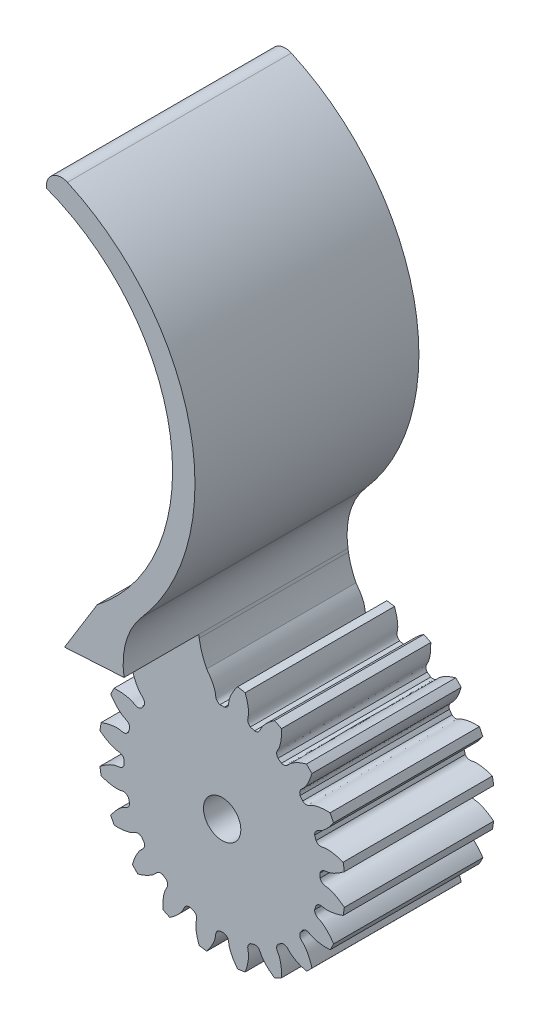
from build123d import *

# Parameters (mm, degrees)
SKETCH_1_R               = 16.5
EXTRUDE_1_DEPTH          = 20
CUT_EXTRUDE_1_DEPTH      = 31.732718721
PATTERN_CIRCULAR_1_COUNT = 20
EXTRUDE_START            = -20
EXTRUDE_2_DEPTH          = 20
FILLET_1_R               = 10
FILLET_2_R               = 2
FILLET_4_R               = 10
SKETCH_5_R               = 2.5
CUT_EXTRUDE_2_DEPTH      = 20
EXTRUDE_3_DEPTH          = 10


with BuildPart() as part:
    # 草图1 → 凸台-拉伸1 (new body)
    with BuildSketch(Plane.XY):
        Circle(SKETCH_1_R)
    extrude(amount=EXTRUDE_1_DEPTH)

    # 草图2 → 切除-拉伸1 (cut, through all)
    with BuildSketch(Plane.XY):
        with BuildLine():
            ThreePointArc((0.289974901, 13.121796354), (0, 13.125), (-0.289974901, 13.121796354))
            add(Edge.make_bspline(
                [(-0.289974901, 13.121796354), (-0.916784107, 13.340213268), (-0.835626149, 13.780670548), (-0.919345585, 14.205014104), (-0.928338279, 14.246334921), (-0.939466335, 14.292951923), (-0.952938145, 14.344795254), (-0.96896871, 14.401787245), (-0.987768083, 14.463844242), (-1.009544807, 14.5308761), (-1.034504625, 14.602786421), (-1.06285065, 14.679472568), (-1.094783098, 14.760825751), (-1.130499153, 14.846731096), (-1.170192797, 14.937067727), (-1.214054647, 15.031708847), (-1.2622718, 15.130521826), (-1.315027675, 15.233368292), (-1.372501858, 15.340104225), (-1.434869948, 15.450580056), (-1.502303414, 15.564640771), (-1.574969439, 15.682126017), (-1.653030782, 15.802870208), (-1.736645634, 15.926702646), (-1.825967477, 16.05344763), (-1.921144951, 16.182924586), (-2.022321721, 16.314948181), (-2.129636342, 16.449328459), (-2.24322214, 16.585870967), (-2.363207078, 16.724376892), (-2.489713645, 16.864643194), (-2.622858733, 17.006462752), (-2.762753527, 17.149624504), (-2.909503389, 17.29391359), (-3.06320776, 17.439111509), (-3.223960048, 17.584996263), (-3.391847534, 17.731342516), (-3.566951278, 17.877921749), (-3.749346018, 18.024502419), (-3.939100102, 18.170850122), (-4.136275349, 18.31672776), (-4.412210386, 18.512459802), (-4.625898619, 18.654498902), (-4.771736973, 18.747377789)],
                knots=[0, 0, 0, 0, 0.165916003, 0.170905922, 0.176663519, 0.183188797, 0.190481754, 0.198542391, 0.207370708, 0.216966704, 0.22733038, 0.238461736, 0.250360771, 0.263027487, 0.276461881, 0.290663956, 0.30563371, 0.321371144, 0.337876258, 0.355149051, 0.373189524, 0.391997677, 0.411573509, 0.431917021, 0.453028213, 0.474907084, 0.497553636, 0.520967867, 0.545149777, 0.570099367, 0.595816637, 0.622301587, 0.649554216, 0.677574526, 0.706362514, 0.735918183, 0.766241531, 0.797332559, 0.829191267, 0.861817654, 0.895211721, 0.929373468, 1, 1, 1, 1], degree=3))
            ThreePointArc((-4.771736973, 18.747377789), (0, 19.345119481), (4.771736973, 18.747377789))
            add(Edge.make_bspline(
                [(0.289974901, 13.121796354), (0.916784107, 13.340213268), (0.835626149, 13.780670548), (0.919345585, 14.205014104), (0.928338279, 14.246334921), (0.939466335, 14.292951923), (0.952938145, 14.344795254), (0.96896871, 14.401787245), (0.987768083, 14.463844242), (1.009544807, 14.5308761), (1.034504625, 14.602786421), (1.06285065, 14.679472568), (1.094783098, 14.760825751), (1.130499153, 14.846731096), (1.170192797, 14.937067727), (1.214054647, 15.031708847), (1.2622718, 15.130521826), (1.315027675, 15.233368292), (1.372501858, 15.340104225), (1.434869948, 15.450580056), (1.502303414, 15.564640771), (1.574969439, 15.682126017), (1.653030782, 15.802870208), (1.736645634, 15.926702646), (1.825967477, 16.05344763), (1.921144951, 16.182924586), (2.022321721, 16.314948181), (2.129636342, 16.449328459), (2.24322214, 16.585870967), (2.363207078, 16.724376892), (2.489713645, 16.864643194), (2.622858733, 17.006462752), (2.762753527, 17.149624504), (2.909503389, 17.29391359), (3.06320776, 17.439111509), (3.223960048, 17.584996263), (3.391847534, 17.731342516), (3.566951278, 17.877921749), (3.749346018, 18.024502419), (3.939100102, 18.170850122), (4.136275349, 18.31672776), (4.412210386, 18.512459802), (4.625898619, 18.654498902), (4.771736973, 18.747377789)],
                knots=[0, 0, 0, 0, 0.165916003, 0.170905922, 0.176663519, 0.183188797, 0.190481754, 0.198542391, 0.207370708, 0.216966704, 0.22733038, 0.238461736, 0.250360771, 0.263027487, 0.276461881, 0.290663956, 0.30563371, 0.321371144, 0.337876258, 0.355149051, 0.373189524, 0.391997677, 0.411573509, 0.431917021, 0.453028213, 0.474907084, 0.497553636, 0.520967867, 0.545149777, 0.570099367, 0.595816637, 0.622301587, 0.649554216, 0.677574526, 0.706362514, 0.735918183, 0.766241531, 0.797332559, 0.829191267, 0.861817654, 0.895211721, 0.929373468, 1, 1, 1, 1], degree=3))
        make_face()
    cut_extrude_1 = extrude(amount=CUT_EXTRUDE_1_DEPTH, mode=Mode.SUBTRACT)

    # 阵列(圆周)1: 切除-拉伸1 ×20 about axis
    pattern_circular_1_axis = Axis((0, 0, -1.5), (0, 0, 1))
    for i in range(1, PATTERN_CIRCULAR_1_COUNT):
        add(cut_extrude_1.rotate(pattern_circular_1_axis, i * 360 / PATTERN_CIRCULAR_1_COUNT), mode=Mode.SUBTRACT)


with BuildPart() as extrude_2_tool:
    # 草图4 → 凸台-拉伸2 (new body)
    with BuildSketch(Plane.XY.offset(20).offset(EXTRUDE_START)):
        with BuildLine():
            Line((-3.093231062, 16.207464996), (-2.581168673, 16.29685762))
            Line((-2.581168673, 16.29685762), (-3.943179305, 24.896254312))
            ThreePointArc((-3.943179305, 24.896254312), (5.496479925, 54.08322336), (-16.546718658, 75.415914817))
            Line((-16.546718658, 75.415914817), (-13.532827403, 71.415914817))
            ThreePointArc((-13.532827403, 71.415914817), (3.341214432, 48.022182491), (-11.762983934, 23.448554518))
            Line((-11.762983934, 23.448554518), (-10.429455191, 15.028985398))
            Line((-10.429455191, 15.028985398), (-9.866251186, 11.473055258))
            add(Edge.make_bspline(
                [(-9.86625116, 11.473055308), (-9.818790017, 11.447845476), (-9.715705209, 11.391138486), (-9.589612349, 11.315967266), (-9.466858859, 11.237556123), (-9.37982057, 11.17834971), (-9.300755502, 11.120900284), (-9.249070303, 11.081745113), (-9.202602252, 11.045060153), (-9.150343301, 11.002082969), (-9.104978437, 10.962582681), (-8.776110671, 10.657627941), (-8.582874544, 10.253587065), (-7.947393003, 10.445313277)],
                knots=[0.701586416, 0.701586416, 0.701586416, 0.701586416, 0.723538119, 0.749639229, 0.761538264, 0.783033296, 0.792629292, 0.801457609, 0.809518246, 0.816811203, 0.829094078, 0.834083997, 1, 1, 1, 1], degree=3))
            ThreePointArc((-7.947393003, 10.445313277), (-7.714681436, 10.618348051), (-7.478203758, 10.786199217))
            add(Edge.make_bspline(
                [(-7.478203758, 10.786199217), (-7.099486698, 11.33133142), (-7.424039159, 11.639965394), (-7.612442624, 12.046973423), (-7.635991116, 12.102324233), (-7.660715943, 12.16530613), (-7.681245996, 12.220836149), (-7.71083511, 12.306060717), (-7.748703597, 12.427161912), (-7.792731572, 12.590510669), (-7.835215538, 12.777480211), (-7.874329115, 12.988173006), (-7.908236264, 13.222583157), (-7.935097524, 13.480595599), (-7.953075711, 13.761985925), (-7.960341751, 14.066420428), (-7.956565619, 14.30111124), (-7.951281332, 14.434194698), (-7.950219677, 14.458354231)],
                knots=[0, 0, 0, 0, 0.165916003, 0.170905922, 0.183188797, 0.190481754, 0.198542391, 0.207370708, 0.22733038, 0.250360771, 0.276461881, 0.30563371, 0.337876258, 0.373189524, 0.411573509, 0.453028213, 0.497553636, 0.507431698, 0.507431698, 0.507431698, 0.507431698], degree=3))
            ThreePointArc((-7.950219677, 14.458354231), (-7.490843246, 14.701607649), (-7.024032405, 14.930270218))
            add(Edge.make_bspline(
                [(-7.024032405, 14.930270218), (-6.912948778, 14.856790614), (-6.720224904, 14.722766352), (-6.458979768, 14.52326582), (-6.24189748, 14.343324096), (-6.048949658, 14.169936981), (-5.879237949, 14.004722705), (-5.731774221, 13.849237063), (-5.623437121, 13.725477592), (-5.530921989, 13.612971249), (-5.466439445, 13.529766293), (-5.408996946, 13.450696193), (-5.371941014, 13.397485807), (-5.339083547, 13.34823692), (-5.302663012, 13.291214284), (-5.271724722, 13.239628764), (-5.053189088, 12.847973843), (-4.994266108, 12.403994888), (-4.330640589, 12.389962756)],
                knots=[0.492568302, 0.492568302, 0.492568302, 0.492568302, 0.546971787, 0.588426491, 0.626810476, 0.662123742, 0.69436629, 0.723538119, 0.749639229, 0.761538264, 0.783033296, 0.792629292, 0.801457609, 0.809518246, 0.816811203, 0.829094078, 0.834083997, 1, 1, 1, 1], degree=3))
            ThreePointArc((-4.330640589, 12.389962756), (-4.055848051, 12.482616776), (-3.779075551, 12.5691771))
            add(Edge.make_bspline(
                [(-3.779075551, 12.5691771), (-3.250439109, 12.970598627), (-3.463733699, 13.364419205), (-3.517143644, 13.809726715), (-3.522435249, 13.869645348), (-3.526487481, 13.937185083), (-3.528853002, 13.996341404), (-3.530658082, 14.086538325), (-3.529250826, 14.213414411), (-3.520646377, 14.382373703), (-3.503274264, 14.573320573), (-3.475365832, 14.785788088), (-3.435176726, 15.019203275), (-3.380993074, 15.272888275), (-3.311136952, 15.546061943), (-3.223971932, 15.837841691), (-3.147857168, 16.059879028), (-3.101706462, 16.184815984), (-3.093231062, 16.207464996)],
                knots=[0, 0, 0, 0, 0.165916003, 0.170905922, 0.183188797, 0.190481754, 0.198542391, 0.207370708, 0.22733038, 0.250360771, 0.276461881, 0.30563371, 0.337876258, 0.373189524, 0.411573509, 0.453028213, 0.497553636, 0.507431698, 0.507431698, 0.507431698, 0.507431698], degree=3))
        make_face()
        with BuildLine():
            Line((-9.866251186, 11.473055258), (-10.429455191, 15.028985398))
            Line((-10.429455191, 15.028985398), (-11.293959017, 12.028985398))
            add(Edge.make_bspline(
                [(-11.293959017, 12.028985398), (-11.165605763, 11.993428871), (-10.940898693, 11.925519176), (-10.630790749, 11.816512081), (-10.368728174, 11.712459448), (-10.131644325, 11.607182659), (-9.967401155, 11.526255764), (-9.881861585, 11.481347063), (-9.86625116, 11.473055308)],
                knots=[0.492568302, 0.492568302, 0.492568302, 0.492568302, 0.546971787, 0.588426491, 0.626810476, 0.662123742, 0.69436629, 0.701586416, 0.701586416, 0.701586416, 0.701586416], degree=3))
        make_face()
    extrude(amount=EXTRUDE_2_DEPTH)


with BuildPart() as part_1:
    add(part.part)


with BuildPart() as part_2:
    # 凸台-拉伸2: joined with extrude_2_tool
    add(part_1.part.fuse(extrude_2_tool.part, tol=0.00001))

    # 圆角1
    # the kernel refuses this fillet: 10 mm, written as the material it adds along each edge
    with BuildSketch(Plane(origin=(-2.581168673, 16.29685762, 0), x_dir=(0.9900299133467211, 0.14085727059219932, 0), z_dir=(0, 0, 1))) as fillet_1_piece_1:
        with BuildLine():
            CenterArc((9.948767375, 3.330870643), FILLET_1_R, 180.902544173, 18.55371105)
            Line((-0.049991965, 3.173353483), (-0.249967152, 3.17020314))
            Line((-0.249967152, 3.17020314), (-0.199975187, -0.003150343))
            Line((-0.199975187, -0.003150343), (0.003150343, -0.199975187))
            ThreePointArc((0.003150343, -0.199975187), (0.259903314, -0.197952911), (0.331227414, -0.066617413))
            Line((0.331227414, -0.066617413), (0.519806629, 0))
        make_face()
    extrude(amount=20)

    # 圆角2
    # the kernel refuses this fillet: 2 mm, written as the material it takes off along each edge
    with BuildSketch(Plane(origin=(-16.546718658, 75.415914817, -15.309873944), x_dir=(0.9500150580414196, -0.3122040830843792, 0), z_dir=(0, 0, 1))) as fillet_2_piece_1:
        with BuildLine():
            CenterArc((5.912778903, -1.988820491), FILLET_2_R, 83.939108601, 121.855430824)
            Line((4.112058409, -2.859111076), (4.076043999, -2.876516888))
            ThreePointArc((4.076043999, -2.876516888), (2.033194436, -1.462397179), (-0.022834768, -0.032841641))
            Line((-0.022834768, -0.032841641), (-0.004223414, 0.03977641))
            ThreePointArc((-0.004223414, 0.03977641), (3.061974789, 0.202102878), (6.128172991, 0.03977641))
            Line((6.128172991, 0.03977641), (6.123949578, 0))
        make_face()
    extrude(amount=50.619747889, mode=Mode.SUBTRACT)

    # 圆角4
    fillet_4_edges = [part_2.edges().sort_by_distance(p)[0] for p in [
        (-3.943179305, 24.896254312, 10),
    ]]
    fillet(fillet_4_edges, radius=FILLET_4_R)

    # 草图5 → 切除-拉伸2 (cut)
    with BuildSketch(Plane.XY.offset(20)):
        Circle(SKETCH_5_R)
    extrude(amount=-CUT_EXTRUDE_2_DEPTH, mode=Mode.SUBTRACT)

    # 倒角1
    # the kernel refuses this chamfer: 7.231890237, 5 mm, written as the material it takes off along each edge
    with BuildSketch(Plane(origin=(-11.762983934, 23.448554518, -15.355722495), x_dir=(0.8550981563883064, 0.5184661444504544, 0), z_dir=(0, 0, 1))) as chamfer_1_piece_1:
        with BuildLine():
            Line((6.140873696, 0.131849833), (-1.814656366, -3.942000238))
            Line((-1.814656366, -3.942000238), (-1.948544176, -3.887281421))
            ThreePointArc((-1.948544176, -3.887281421), (-0.953988417, -1.951930476), (-0.13388781, 0.054718816))
            Line((-0.13388781, 0.054718816), (0.016364637, 0.143709057))
            ThreePointArc((0.016364637, 0.143709057), (3.070876099, -0.021990502), (6.124509059, 0.27555889))
            Line((6.124509059, 0.27555889), (6.140873696, 0.131849833))
        make_face()
    extrude(amount=50.71144499, mode=Mode.SUBTRACT)

    # 草图6 → 凸台-拉伸3 (add)
    with BuildSketch(Plane.XY.offset(20)):
        with BuildLine():
            Line((-6.732104913, 26.498894914), (-11.119088501, 19.383158754))
            Line((-11.119088501, 19.383158754), (-3.143187248, 19.84530325))
            ThreePointArc((-3.143187248, 19.84530325), (-2.875747559, 24.177063926), (-0.798304327, 27.987563126))
            ThreePointArc((-0.798304327, 27.987563126), (5.692388604, 53.245191712), (-10.728874345, 73.503992754))
            ThreePointArc((-10.728874345, 73.503992754), (-12.744950062, 73.284590293), (-13.532827403, 71.415914817))
            ThreePointArc((-13.532827403, 71.415914817), (3.065911467, 50.955723181), (-6.732104913, 26.498894914))
        make_face()
    extrude(amount=EXTRUDE_3_DEPTH)


solid = part_2.part
